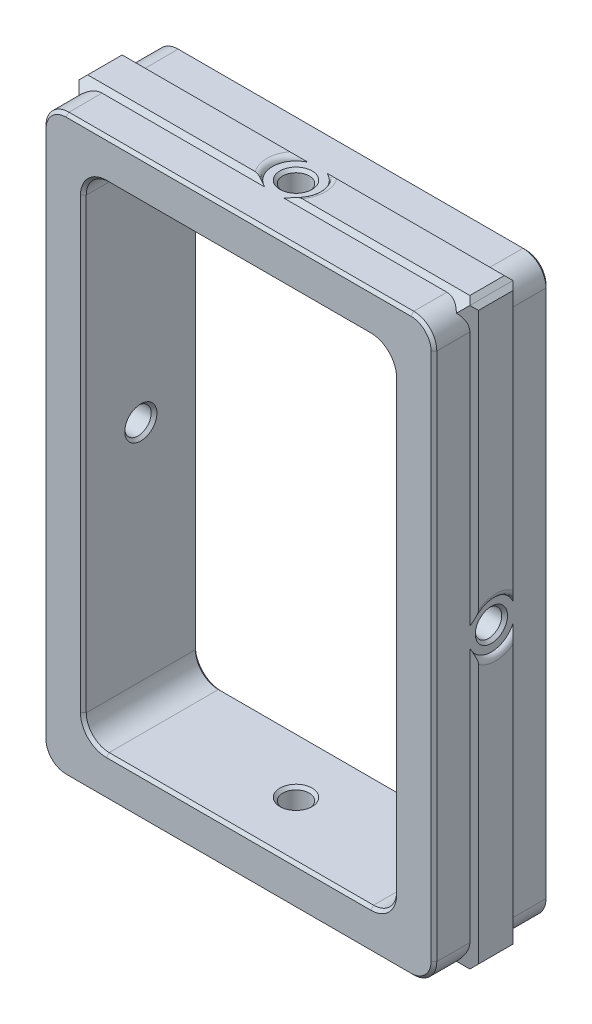
from build123d import *

# Parameters (mm, degrees)
SKIZZE1_W                       = 68
SKIZZE1_H                       = 100
AUFSATZ_LINEAR_AUSTRAGEN1_DEPTH = 20
AUFSATZ_LINEAR_AUSTRAGEN3_DEPTH = 100
AUFSATZ_LINEAR_AUSTRAGEN4_DEPTH = 68
SKIZZE5_R                       = 2.3
SCHNITT_LINEAR_AUSTRAGEN1_DEPTH = 20
SKIZZE6_R                       = 2.3
SCHNITT_LINEAR_AUSTRAGEN2_DEPTH = 20
SKIZZE7_R                       = 4.1
SCHNITT_LINEAR_AUSTRAGEN3_DEPTH = 20
SKIZZE8_R                       = 4.1
SCHNITT_LINEAR_AUSTRAGEN4_DEPTH = 20
VERRUNDUNG1_R                   = 1
FASE1_SIZE                      = 0.75
VERRUNDUNG2_R                   = 4
FILLET1_R                       = 4
CHAMFER1_SIZE                   = 0.5


# Some blends are built 0.0001 mm under size
with BuildPart() as part:
    # Skizze1 → Aufsatz-Linear austragen1 (new body)
    with BuildSketch(Plane.XY):
        with Locations((34, 50)):
            Rectangle(SKIZZE1_W, SKIZZE1_H)
        Polygon((11.132768182, 7), (7, 7), (7, 13.581815994), (7, 86.418184006), (7, 93), (11.132768182, 93), (56.867231818, 93), (61, 93), (61, 86.418184006), (61, 13.581815994), (61, 7), (56.867231818, 7), align=None, mode=Mode.SUBTRACT)
    extrude(amount=AUFSATZ_LINEAR_AUSTRAGEN1_DEPTH)

    # Skizze3 → Aufsatz-Linear austragen3 (add)
    with BuildSketch(Plane.XZ):
        Polygon((0, 13.75), (-0.75, 13), (-0.75, 7), (0, 6.25), align=None)
        Polygon((68, 13.75), (68.75, 13), (68.75, 7), (68, 6.25), align=None)
    extrude(amount=-AUFSATZ_LINEAR_AUSTRAGEN3_DEPTH)

    # Skizze4 → Aufsatz-Linear austragen4 (add)
    with BuildSketch(Plane.ZY):
        Polygon((13.75, 100), (13, 100.75), (7, 100.75), (6.25, 100), align=None)
        Polygon((13.75, 0), (13, -0.75), (7, -0.75), (6.25, 0), align=None)
    extrude(amount=-AUFSATZ_LINEAR_AUSTRAGEN4_DEPTH)

    # Skizze5 → Schnitt-Linear austragen1 (cut)
    with BuildSketch(Plane.XZ.offset(-93)):
        with Locations(Location((34, 10, 0), (0, 0, 270))):
            Circle(SKIZZE5_R)
    schnitt_linear_austragen1 = extrude(amount=-SCHNITT_LINEAR_AUSTRAGEN1_DEPTH, mode=Mode.SUBTRACT)

    # Skizze6 → Schnitt-Linear austragen2 (cut)
    with BuildSketch(Plane(origin=(7, 0, 0), x_dir=(0, 0, -1), z_dir=(1, 0, 0))):
        with Locations(Location((-10, 50, 0), (0, 0, 90))):
            Circle(SKIZZE6_R)
    schnitt_linear_austragen2 = extrude(amount=-SCHNITT_LINEAR_AUSTRAGEN2_DEPTH, mode=Mode.SUBTRACT)

    # Skizze7 → Schnitt-Linear austragen3 (cut)
    with BuildSketch(Plane(origin=(0, 100, 0), x_dir=(1, 0, 0), z_dir=(0, 1, 0))):
        with Locations((34, -10)):
            Circle(SKIZZE7_R)
    schnitt_linear_austragen3 = extrude(amount=SCHNITT_LINEAR_AUSTRAGEN3_DEPTH, mode=Mode.SUBTRACT)

    # Skizze8 → Schnitt-Linear austragen4 (cut)
    with BuildSketch(Plane.ZY):
        with Locations((10, 50)):
            Circle(SKIZZE8_R)
    schnitt_linear_austragen4 = extrude(amount=SCHNITT_LINEAR_AUSTRAGEN4_DEPTH, mode=Mode.SUBTRACT)

    # Spiegeln1: Schnitt-Linear austragen1, Schnitt-Linear austragen3 across plane
    add(schnitt_linear_austragen1.mirror(Plane.ZX.offset(50)), mode=Mode.SUBTRACT)
    add(schnitt_linear_austragen3.mirror(Plane.ZX.offset(50)), mode=Mode.SUBTRACT)

    # Spiegeln2: Schnitt-Linear austragen2, Schnitt-Linear austragen4 across plane
    add(schnitt_linear_austragen2.mirror(Plane.ZY.offset(-34)), mode=Mode.SUBTRACT)
    add(schnitt_linear_austragen4.mirror(Plane.ZY.offset(-34)), mode=Mode.SUBTRACT)

    # Verrundung1
    # the kernel refuses this fillet: 1 mm, written as the material it takes off along each edge
    with BuildSketch(Plane(origin=(-0.75, 50, 10), x_dir=(0, -0.15864693670846175, 0.9873353784165851), z_dir=(0, 0.9873353784165851, 0.15864693670846175))) as verrundung1_piece_1:
        with BuildLine():
            CenterArc((5.068245837, 1), VERRUNDUNG1_R, 194.477512186, 75.522487814)
            Line((5.068245837, 0), (5.068245837, -0.02))
            Line((5.068245837, -0.02), (4.1, -0.02))
            Line((4.1, -0.02), (4.08, 0))
            ThreePointArc((4.08, 0), (4.08, 0.375), (4.080635083, 0.745))
            Line((4.080635083, 0.745), (4.1, 0.75))
        make_face()
    revolve(axis=Axis((-0.75, 50, 10), (1, 0, 0)), revolution_arc=161.743263365, mode=Mode.SUBTRACT)
    with BuildSketch(Plane(origin=(-0.75, 50, 10), x_dir=(0, 0.15864693670846175, -0.9873353784165851), z_dir=(0, -0.9873353784165851, -0.15864693670846175))) as verrundung1_piece_2:
        with BuildLine():
            CenterArc((5.068245837, 1), VERRUNDUNG1_R, 194.477512186, 75.522487814)
            Line((5.068245837, 0), (5.068245837, -0.02))
            Line((5.068245837, -0.02), (4.1, -0.02))
            Line((4.1, -0.02), (4.08, 0))
            ThreePointArc((4.08, 0), (4.08, 0.375), (4.080635083, 0.745))
            Line((4.080635083, 0.745), (4.1, 0.75))
        make_face()
    revolve(axis=Axis((-0.75, 50, 10), (1, 0, 0)), revolution_arc=161.743263365, mode=Mode.SUBTRACT)
    with BuildSketch(Plane(origin=(34, 100.75, 10), x_dir=(0.15864693670847052, 0, 0.9873353784165836), z_dir=(-0.9873353784165836, 0, 0.15864693670847052))) as verrundung1_piece_3:
        with BuildLine():
            CenterArc((5.068245837, -1), VERRUNDUNG1_R, 90, 75.522487814)
            Line((5.068245837, 0), (5.068245837, 0.02))
            Line((5.068245837, 0.02), (4.1, 0.02))
            Line((4.1, 0.02), (4.08, 0))
            ThreePointArc((4.08, 0), (4.08, -0.375), (4.080635083, -0.745))
            Line((4.080635083, -0.745), (4.1, -0.75))
        make_face()
    revolve(axis=Axis((34, 100.75, 10), (0, 1, 0)), revolution_arc=161.743263365, mode=Mode.SUBTRACT)
    with BuildSketch(Plane(origin=(34, 100.75, 10), x_dir=(-0.15864693670847044, 0, 0.9873353784165836), z_dir=(0.9873353784165836, 0, 0.15864693670847044))) as verrundung1_piece_4:
        with BuildLine():
            CenterArc((5.068245837, 1), VERRUNDUNG1_R, 194.477512186, 75.522487814)
            Line((5.068245837, 0), (5.068245837, -0.02))
            Line((5.068245837, -0.02), (4.1, -0.02))
            Line((4.1, -0.02), (4.08, 0))
            ThreePointArc((4.08, 0), (4.08, 0.375), (4.080635083, 0.745))
            Line((4.080635083, 0.745), (4.1, 0.75))
        make_face()
    revolve(axis=Axis((34, 100.75, 10), (0, -1, 0)), revolution_arc=161.743263365, mode=Mode.SUBTRACT)
    with BuildSketch(Plane(origin=(68.75, 50, 10), x_dir=(0, -0.15864693670847907, -0.9873353784165824), z_dir=(0, 0.9873353784165824, -0.15864693670847907))) as verrundung1_piece_5:
        with BuildLine():
            CenterArc((5.068245837, 1), VERRUNDUNG1_R, 194.477512186, 75.522487814)
            Line((4.1, 0.75), (4.080635083, 0.745))
            ThreePointArc((4.080635083, 0.745), (4.08, 0.375), (4.08, 0))
            Line((4.08, 0), (4.1, -0.02))
            Line((4.1, -0.02), (5.068245837, -0.02))
            Line((5.068245837, -0.02), (5.068245837, 0))
        make_face()
    revolve(axis=Axis((68.75, 50, 10), (-1, 0, 0)), revolution_arc=161.743263365, mode=Mode.SUBTRACT)
    with BuildSketch(Plane(origin=(68.75, 50, 10), x_dir=(0, 0.15864693670846175, 0.9873353784165851), z_dir=(0, -0.9873353784165851, 0.15864693670846175))) as verrundung1_piece_6:
        with BuildLine():
            CenterArc((5.068245837, 1), VERRUNDUNG1_R, 194.477512186, 75.522487814)
            Line((5.068245837, 0), (5.068245837, -0.02))
            Line((5.068245837, -0.02), (4.1, -0.02))
            Line((4.1, -0.02), (4.08, 0))
            ThreePointArc((4.08, 0), (4.08, 0.375), (4.080635083, 0.745))
            Line((4.080635083, 0.745), (4.1, 0.75))
        make_face()
    revolve(axis=Axis((68.75, 50, 10), (-1, 0, 0)), revolution_arc=161.743263365, mode=Mode.SUBTRACT)
    with BuildSketch(Plane(origin=(34, -0.75, 10), x_dir=(0.1586469367084636, 0, -0.9873353784165849), z_dir=(-0.9873353784165849, 0, -0.1586469367084636))) as verrundung1_piece_7:
        with BuildLine():
            CenterArc((5.068245837, -1), VERRUNDUNG1_R, 90, 75.522487814)
            Line((5.068245837, 0), (5.068245837, 0.02))
            Line((5.068245837, 0.02), (4.1, 0.02))
            Line((4.1, 0.02), (4.08, 0))
            ThreePointArc((4.08, 0), (4.08, -0.375), (4.080635083, -0.745))
            Line((4.080635083, -0.745), (4.1, -0.75))
        make_face()
    revolve(axis=Axis((34, -0.75, 10), (0, -1, 0)), revolution_arc=161.743263365, mode=Mode.SUBTRACT)
    with BuildSketch(Plane(origin=(34, -0.75, 10), x_dir=(-0.15864693670846183, 0, -0.9873353784165851), z_dir=(0.9873353784165851, 0, -0.15864693670846183))) as verrundung1_piece_8:
        with BuildLine():
            CenterArc((5.068245837, 1), VERRUNDUNG1_R, 194.477512186, 75.522487814)
            Line((5.068245837, 0), (5.068245837, -0.02))
            Line((5.068245837, -0.02), (4.1, -0.02))
            Line((4.1, -0.02), (4.08, 0))
            ThreePointArc((4.08, 0), (4.08, 0.375), (4.080635083, 0.745))
            Line((4.080635083, 0.745), (4.1, 0.75))
        make_face()
    revolve(axis=Axis((34, -0.75, 10), (0, 1, 0)), revolution_arc=161.743263365, mode=Mode.SUBTRACT)

    # Fase1
    fase1_edges = [part.edges().sort_by_distance(p)[0] for p in [
        (68.75, 100, 10),
        (68.75, 0, 10),
        (68, 100.75, 10),
        (-0.75, 0, 10),
        (-0.75, 100, 10),
        (0, 100.75, 10),
        (0, -0.75, 10),
        (68, -0.75, 10),
    ]]
    chamfer(fase1_edges, length=FASE1_SIZE - 0.0001)  # a hair under: the kernel refuses the full size

    # Verrundung2
    # the kernel refuses this fillet: 4 mm, written as the material it takes off along each edge
    with BuildSketch(Plane(origin=(0, 0, 3.75), x_dir=(1, 0, 0), z_dir=(0, 0, 1))) as verrundung2_piece_1_section:
        with BuildLine():
            CenterArc((VERRUNDUNG2_R, VERRUNDUNG2_R), VERRUNDUNG2_R, 180, 90)
            Line((0, VERRUNDUNG2_R), (0, 0))
            Line((0, 0), (VERRUNDUNG2_R, 0))
        make_face()
    verrundung2_piece_1 = extrude(amount=26.25, mode=Mode.PRIVATE)
    verrundung2_piece_1 = split(verrundung2_piece_1, bisect_by=Plane(origin=(2.04000306, 0.608628582, 5.641371418), z_dir=(0, -0.7071067811865519, -0.7071067811865434)), keep=Keep.TOP, mode=Mode.PRIVATE)
    verrundung2_piece_1 = split(verrundung2_piece_1, bisect_by=Plane(origin=(1.537282973, 0.182694278, 4.712717027), z_dir=(0.7071067811865467, 0, 0.7071067811865483)), keep=Keep.TOP, mode=Mode.PRIVATE)
    add(verrundung2_piece_1, mode=Mode.SUBTRACT)
    with BuildSketch(Plane(origin=(0, 0, 3.75), x_dir=(1, 0, 0), z_dir=(0, 0, 1))) as verrundung2_piece_2_section:
        with BuildLine():
            CenterArc((VERRUNDUNG2_R, VERRUNDUNG2_R), VERRUNDUNG2_R, 180, 90)
            Line((0, VERRUNDUNG2_R), (0, 0))
            Line((0, 0), (VERRUNDUNG2_R, 0))
        make_face()
    verrundung2_piece_2 = extrude(amount=26.25, mode=Mode.PRIVATE)
    verrundung2_piece_2 = split(verrundung2_piece_2, bisect_by=Plane(origin=(0.675367525, 1.214801338, 5.035198662), z_dir=(0, -0.7071067811865519, -0.7071067811865434)), keep=Keep.TOP, mode=Mode.PRIVATE)
    verrundung2_piece_2 = split(verrundung2_piece_2, bisect_by=Plane(origin=(1.214801338, 0.675367525, 5.035198662), z_dir=(-0.7071067811865467, 0, -0.7071067811865483)), keep=Keep.TOP, mode=Mode.PRIVATE)
    add(verrundung2_piece_2, mode=Mode.SUBTRACT)
    with BuildSketch(Plane(origin=(0, 0, 3.75), x_dir=(1, 0, 0), z_dir=(0, 0, 1))) as verrundung2_piece_3_section:
        with BuildLine():
            CenterArc((VERRUNDUNG2_R, VERRUNDUNG2_R), VERRUNDUNG2_R, 180, 90)
            Line((0, VERRUNDUNG2_R), (0, 0))
            Line((0, 0), (VERRUNDUNG2_R, 0))
        make_face()
    verrundung2_piece_3 = extrude(amount=26.25, mode=Mode.PRIVATE)
    verrundung2_piece_3 = split(verrundung2_piece_3, bisect_by=Plane(origin=(0.182694278, 1.537282973, 4.712717027), z_dir=(0, 0.7071067811865519, 0.7071067811865434)), keep=Keep.TOP, mode=Mode.PRIVATE)
    verrundung2_piece_3 = split(verrundung2_piece_3, bisect_by=Plane(origin=(0.608628582, 2.04000306, 5.641371418), z_dir=(-0.7071067811865467, 0, -0.7071067811865483)), keep=Keep.TOP, mode=Mode.PRIVATE)
    add(verrundung2_piece_3, mode=Mode.SUBTRACT)
    with BuildSketch(Plane(origin=(0, 0, 3.75), x_dir=(1, 0, 0), z_dir=(0, 0, 1))) as verrundung2_piece_4_section:
        with BuildLine():
            CenterArc((VERRUNDUNG2_R, VERRUNDUNG2_R), VERRUNDUNG2_R, 180, 90)
            Line((0, VERRUNDUNG2_R), (0, 0))
            Line((0, 0), (VERRUNDUNG2_R, 0))
        make_face()
    verrundung2_piece_4 = extrude(amount=26.25, mode=Mode.PRIVATE)
    verrundung2_piece_4 = split(verrundung2_piece_4, bisect_by=Plane(origin=(0.171927832, 1.629764539, 15.379764539), z_dir=(0, 0.7071067811865515, -0.7071067811865437)), keep=Keep.TOP, mode=Mode.PRIVATE)
    verrundung2_piece_4 = split(verrundung2_piece_4, bisect_by=Plane(origin=(0.657873401, 2.115710108, 14.407873401), z_dir=(-0.707106781186546, 0, 0.7071067811865491)), keep=Keep.TOP, mode=Mode.PRIVATE)
    add(verrundung2_piece_4, mode=Mode.SUBTRACT)
    with BuildSketch(Plane(origin=(0, 0, 3.75), x_dir=(1, 0, 0), z_dir=(0, 0, 1))) as verrundung2_piece_5_section:
        with BuildLine():
            CenterArc((VERRUNDUNG2_R, VERRUNDUNG2_R), VERRUNDUNG2_R, 180, 90)
            Line((0, VERRUNDUNG2_R), (0, 0))
            Line((0, 0), (VERRUNDUNG2_R, 0))
        make_face()
    verrundung2_piece_5 = extrude(amount=26.25, mode=Mode.PRIVATE)
    verrundung2_piece_5 = split(verrundung2_piece_5, bisect_by=Plane(origin=(2.115710108, 0.657873401, 14.407873401), z_dir=(0, -0.7071067811865515, 0.7071067811865437)), keep=Keep.TOP, mode=Mode.PRIVATE)
    verrundung2_piece_5 = split(verrundung2_piece_5, bisect_by=Plane(origin=(1.629764539, 0.171927832, 15.379764539), z_dir=(0.707106781186546, 0, -0.7071067811865491)), keep=Keep.TOP, mode=Mode.PRIVATE)
    add(verrundung2_piece_5, mode=Mode.SUBTRACT)
    with BuildSketch(Plane(origin=(0, 0, 3.75), x_dir=(1, 0, 0), z_dir=(0, 0, 1))) as verrundung2_piece_6_section:
        with BuildLine():
            CenterArc((VERRUNDUNG2_R, VERRUNDUNG2_R), VERRUNDUNG2_R, 180, 90)
            Line((0, VERRUNDUNG2_R), (0, 0))
            Line((0, 0), (VERRUNDUNG2_R, 0))
        make_face()
    verrundung2_piece_6 = extrude(amount=26.25, mode=Mode.PRIVATE)
    verrundung2_piece_6 = split(verrundung2_piece_6, bisect_by=Plane(origin=(0.885415687, 4.872494138, 18.622494138), z_dir=(0, -0.7071067811865515, 0.7071067811865437)), keep=Keep.TOP, mode=Mode.PRIVATE)
    verrundung2_piece_6 = split(verrundung2_piece_6, bisect_by=Plane(origin=(4.872494138, 0.885415687, 18.622494138), z_dir=(-0.707106781186546, 0, 0.7071067811865491)), keep=Keep.TOP, mode=Mode.PRIVATE)
    add(verrundung2_piece_6, mode=Mode.SUBTRACT)
    with BuildSketch(Plane(origin=(0, 100, 3.75), x_dir=(0, -1, 0), z_dir=(0, 0, 1))) as verrundung2_piece_7_section:
        with BuildLine():
            CenterArc((VERRUNDUNG2_R, VERRUNDUNG2_R), VERRUNDUNG2_R, 180, 90)
            Line((0, VERRUNDUNG2_R), (0, 0))
            Line((0, 0), (VERRUNDUNG2_R, 0))
        make_face()
    verrundung2_piece_7 = extrude(amount=26.25, mode=Mode.PRIVATE)
    verrundung2_piece_7 = split(verrundung2_piece_7, bisect_by=Plane(origin=(0.608628582, 97.95999694, 5.641371418), z_dir=(-0.7071067811865467, 0, -0.7071067811865483)), keep=Keep.TOP, mode=Mode.PRIVATE)
    verrundung2_piece_7 = split(verrundung2_piece_7, bisect_by=Plane(origin=(0.182694278, 98.462717027, 4.712717027), z_dir=(0, -0.7071067811865521, 0.7071067811865429)), keep=Keep.TOP, mode=Mode.PRIVATE)
    add(verrundung2_piece_7, mode=Mode.SUBTRACT)
    with BuildSketch(Plane(origin=(0, 100, 3.75), x_dir=(0, -1, 0), z_dir=(0, 0, 1))) as verrundung2_piece_8_section:
        with BuildLine():
            CenterArc((VERRUNDUNG2_R, VERRUNDUNG2_R), VERRUNDUNG2_R, 180, 90)
            Line((0, VERRUNDUNG2_R), (0, 0))
            Line((0, 0), (VERRUNDUNG2_R, 0))
        make_face()
    verrundung2_piece_8 = extrude(amount=26.25, mode=Mode.PRIVATE)
    verrundung2_piece_8 = split(verrundung2_piece_8, bisect_by=Plane(origin=(1.214801338, 99.324632475, 5.035198662), z_dir=(-0.7071067811865467, 0, -0.7071067811865483)), keep=Keep.TOP, mode=Mode.PRIVATE)
    verrundung2_piece_8 = split(verrundung2_piece_8, bisect_by=Plane(origin=(0.675367525, 98.785198662, 5.035198662), z_dir=(0, 0.7071067811865521, -0.7071067811865429)), keep=Keep.TOP, mode=Mode.PRIVATE)
    add(verrundung2_piece_8, mode=Mode.SUBTRACT)
    with BuildSketch(Plane(origin=(0, 100, 3.75), x_dir=(0, -1, 0), z_dir=(0, 0, 1))) as verrundung2_piece_9_section:
        with BuildLine():
            CenterArc((VERRUNDUNG2_R, VERRUNDUNG2_R), VERRUNDUNG2_R, 180, 90)
            Line((0, VERRUNDUNG2_R), (0, 0))
            Line((0, 0), (VERRUNDUNG2_R, 0))
        make_face()
    verrundung2_piece_9 = extrude(amount=26.25, mode=Mode.PRIVATE)
    verrundung2_piece_9 = split(verrundung2_piece_9, bisect_by=Plane(origin=(1.537282973, 99.817305722, 4.712717027), z_dir=(0.7071067811865467, 0, 0.7071067811865483)), keep=Keep.TOP, mode=Mode.PRIVATE)
    verrundung2_piece_9 = split(verrundung2_piece_9, bisect_by=Plane(origin=(2.04000306, 99.391371418, 5.641371418), z_dir=(0, 0.7071067811865521, -0.7071067811865429)), keep=Keep.TOP, mode=Mode.PRIVATE)
    add(verrundung2_piece_9, mode=Mode.SUBTRACT)
    with BuildSketch(Plane(origin=(0, 100, 3.75), x_dir=(0, -1, 0), z_dir=(0, 0, 1))) as verrundung2_piece_10_section:
        with BuildLine():
            CenterArc((VERRUNDUNG2_R, VERRUNDUNG2_R), VERRUNDUNG2_R, 180, 90)
            Line((0, VERRUNDUNG2_R), (0, 0))
            Line((0, 0), (VERRUNDUNG2_R, 0))
        make_face()
    verrundung2_piece_10 = extrude(amount=26.25, mode=Mode.PRIVATE)
    verrundung2_piece_10 = split(verrundung2_piece_10, bisect_by=Plane(origin=(1.629764539, 99.828072168, 15.379764539), z_dir=(0.707106781186546, 0, -0.7071067811865491)), keep=Keep.TOP, mode=Mode.PRIVATE)
    verrundung2_piece_10 = split(verrundung2_piece_10, bisect_by=Plane(origin=(2.115710108, 99.342126599, 14.407873401), z_dir=(0, 0.7071067811865518, 0.7071067811865434)), keep=Keep.TOP, mode=Mode.PRIVATE)
    add(verrundung2_piece_10, mode=Mode.SUBTRACT)
    with BuildSketch(Plane(origin=(0, 100, 3.75), x_dir=(0, -1, 0), z_dir=(0, 0, 1))) as verrundung2_piece_11_section:
        with BuildLine():
            CenterArc((VERRUNDUNG2_R, VERRUNDUNG2_R), VERRUNDUNG2_R, 180, 90)
            Line((0, VERRUNDUNG2_R), (0, 0))
            Line((0, 0), (VERRUNDUNG2_R, 0))
        make_face()
    verrundung2_piece_11 = extrude(amount=26.25, mode=Mode.PRIVATE)
    verrundung2_piece_11 = split(verrundung2_piece_11, bisect_by=Plane(origin=(0.657873401, 97.884289892, 14.407873401), z_dir=(-0.707106781186546, 0, 0.7071067811865491)), keep=Keep.TOP, mode=Mode.PRIVATE)
    verrundung2_piece_11 = split(verrundung2_piece_11, bisect_by=Plane(origin=(0.171927832, 98.370235461, 15.379764539), z_dir=(0, -0.7071067811865518, -0.7071067811865434)), keep=Keep.TOP, mode=Mode.PRIVATE)
    add(verrundung2_piece_11, mode=Mode.SUBTRACT)
    with BuildSketch(Plane(origin=(0, 100, 3.75), x_dir=(0, -1, 0), z_dir=(0, 0, 1))) as verrundung2_piece_12_section:
        with BuildLine():
            CenterArc((VERRUNDUNG2_R, VERRUNDUNG2_R), VERRUNDUNG2_R, 180, 90)
            Line((0, VERRUNDUNG2_R), (0, 0))
            Line((0, 0), (VERRUNDUNG2_R, 0))
        make_face()
    verrundung2_piece_12 = extrude(amount=26.25, mode=Mode.PRIVATE)
    verrundung2_piece_12 = split(verrundung2_piece_12, bisect_by=Plane(origin=(4.872494138, 99.114584313, 18.622494138), z_dir=(-0.707106781186546, 0, 0.7071067811865491)), keep=Keep.TOP, mode=Mode.PRIVATE)
    verrundung2_piece_12 = split(verrundung2_piece_12, bisect_by=Plane(origin=(0.885415687, 95.127505862, 18.622494138), z_dir=(0, 0.7071067811865518, 0.7071067811865434)), keep=Keep.TOP, mode=Mode.PRIVATE)
    add(verrundung2_piece_12, mode=Mode.SUBTRACT)
    with BuildSketch(Plane(origin=(68, 100, 3.75), x_dir=(0, -1, 0), z_dir=(0, 0, 1))) as verrundung2_piece_13_section:
        with BuildLine():
            CenterArc((VERRUNDUNG2_R, -VERRUNDUNG2_R), VERRUNDUNG2_R, 90, 90)
            Line((0, -VERRUNDUNG2_R), (0, 0))
            Line((0, 0), (VERRUNDUNG2_R, 0))
        make_face()
    verrundung2_piece_13 = extrude(amount=26.25, mode=Mode.PRIVATE)
    verrundung2_piece_13 = split(verrundung2_piece_13, bisect_by=Plane(origin=(67.391371418, 97.95999694, 5.641371418), z_dir=(0.7071067811865542, 0, -0.7071067811865409)), keep=Keep.TOP, mode=Mode.PRIVATE)
    verrundung2_piece_13 = split(verrundung2_piece_13, bisect_by=Plane(origin=(67.817305722, 98.462717027, 4.712717027), z_dir=(0, -0.7071067811865521, 0.7071067811865429)), keep=Keep.TOP, mode=Mode.PRIVATE)
    add(verrundung2_piece_13, mode=Mode.SUBTRACT)
    with BuildSketch(Plane(origin=(68, 100, 3.75), x_dir=(0, -1, 0), z_dir=(0, 0, 1))) as verrundung2_piece_14_section:
        with BuildLine():
            CenterArc((VERRUNDUNG2_R, -VERRUNDUNG2_R), VERRUNDUNG2_R, 90, 90)
            Line((0, -VERRUNDUNG2_R), (0, 0))
            Line((0, 0), (VERRUNDUNG2_R, 0))
        make_face()
    verrundung2_piece_14 = extrude(amount=26.25, mode=Mode.PRIVATE)
    verrundung2_piece_14 = split(verrundung2_piece_14, bisect_by=Plane(origin=(66.785198662, 99.324632475, 5.035198662), z_dir=(0.7071067811865542, 0, -0.7071067811865409)), keep=Keep.TOP, mode=Mode.PRIVATE)
    verrundung2_piece_14 = split(verrundung2_piece_14, bisect_by=Plane(origin=(67.324632475, 98.785198662, 5.035198662), z_dir=(0, 0.7071067811865521, -0.7071067811865429)), keep=Keep.TOP, mode=Mode.PRIVATE)
    add(verrundung2_piece_14, mode=Mode.SUBTRACT)
    with BuildSketch(Plane(origin=(68, 100, 3.75), x_dir=(0, -1, 0), z_dir=(0, 0, 1))) as verrundung2_piece_15_section:
        with BuildLine():
            CenterArc((VERRUNDUNG2_R, -VERRUNDUNG2_R), VERRUNDUNG2_R, 90, 90)
            Line((0, -VERRUNDUNG2_R), (0, 0))
            Line((0, 0), (VERRUNDUNG2_R, 0))
        make_face()
    verrundung2_piece_15 = extrude(amount=26.25, mode=Mode.PRIVATE)
    verrundung2_piece_15 = split(verrundung2_piece_15, bisect_by=Plane(origin=(66.462717027, 99.817305722, 4.712717027), z_dir=(-0.7071067811865542, 0, 0.7071067811865409)), keep=Keep.TOP, mode=Mode.PRIVATE)
    verrundung2_piece_15 = split(verrundung2_piece_15, bisect_by=Plane(origin=(65.95999694, 99.391371418, 5.641371418), z_dir=(0, 0.7071067811865521, -0.7071067811865429)), keep=Keep.TOP, mode=Mode.PRIVATE)
    add(verrundung2_piece_15, mode=Mode.SUBTRACT)
    with BuildSketch(Plane(origin=(68, 100, 3.75), x_dir=(0, -1, 0), z_dir=(0, 0, 1))) as verrundung2_piece_16_section:
        with BuildLine():
            CenterArc((VERRUNDUNG2_R, -VERRUNDUNG2_R), VERRUNDUNG2_R, 90, 90)
            Line((0, -VERRUNDUNG2_R), (0, 0))
            Line((0, 0), (VERRUNDUNG2_R, 0))
        make_face()
    verrundung2_piece_16 = extrude(amount=26.25, mode=Mode.PRIVATE)
    verrundung2_piece_16 = split(verrundung2_piece_16, bisect_by=Plane(origin=(66.370235461, 99.828072168, 15.379764539), z_dir=(-0.7071067811865533, 0, -0.7071067811865417)), keep=Keep.TOP, mode=Mode.PRIVATE)
    verrundung2_piece_16 = split(verrundung2_piece_16, bisect_by=Plane(origin=(65.884289892, 99.342126599, 14.407873401), z_dir=(0, 0.7071067811865518, 0.7071067811865434)), keep=Keep.TOP, mode=Mode.PRIVATE)
    add(verrundung2_piece_16, mode=Mode.SUBTRACT)
    with BuildSketch(Plane(origin=(68, 100, 3.75), x_dir=(0, -1, 0), z_dir=(0, 0, 1))) as verrundung2_piece_17_section:
        with BuildLine():
            CenterArc((VERRUNDUNG2_R, -VERRUNDUNG2_R), VERRUNDUNG2_R, 90, 90)
            Line((0, -VERRUNDUNG2_R), (0, 0))
            Line((0, 0), (VERRUNDUNG2_R, 0))
        make_face()
    verrundung2_piece_17 = extrude(amount=26.25, mode=Mode.PRIVATE)
    verrundung2_piece_17 = split(verrundung2_piece_17, bisect_by=Plane(origin=(67.342126599, 97.884289892, 14.407873401), z_dir=(0.7071067811865533, 0, 0.7071067811865417)), keep=Keep.TOP, mode=Mode.PRIVATE)
    verrundung2_piece_17 = split(verrundung2_piece_17, bisect_by=Plane(origin=(67.828072168, 98.370235461, 15.379764539), z_dir=(0, -0.7071067811865518, -0.7071067811865434)), keep=Keep.TOP, mode=Mode.PRIVATE)
    add(verrundung2_piece_17, mode=Mode.SUBTRACT)
    with BuildSketch(Plane(origin=(68, 100, 3.75), x_dir=(0, -1, 0), z_dir=(0, 0, 1))) as verrundung2_piece_18_section:
        with BuildLine():
            CenterArc((VERRUNDUNG2_R, -VERRUNDUNG2_R), VERRUNDUNG2_R, 90, 90)
            Line((0, -VERRUNDUNG2_R), (0, 0))
            Line((0, 0), (VERRUNDUNG2_R, 0))
        make_face()
    verrundung2_piece_18 = extrude(amount=26.25, mode=Mode.PRIVATE)
    verrundung2_piece_18 = split(verrundung2_piece_18, bisect_by=Plane(origin=(63.127505862, 99.114584313, 18.622494138), z_dir=(0.7071067811865533, 0, 0.7071067811865417)), keep=Keep.TOP, mode=Mode.PRIVATE)
    verrundung2_piece_18 = split(verrundung2_piece_18, bisect_by=Plane(origin=(67.114584313, 95.127505862, 18.622494138), z_dir=(0, 0.7071067811865518, 0.7071067811865434)), keep=Keep.TOP, mode=Mode.PRIVATE)
    add(verrundung2_piece_18, mode=Mode.SUBTRACT)
    with BuildSketch(Plane(origin=(68, 0, 3.75), x_dir=(-1, 0, 0), z_dir=(0, 0, 1))) as verrundung2_piece_19_section:
        with BuildLine():
            CenterArc((VERRUNDUNG2_R, -VERRUNDUNG2_R), VERRUNDUNG2_R, 90, 90)
            Line((0, -VERRUNDUNG2_R), (0, 0))
            Line((0, 0), (VERRUNDUNG2_R, 0))
        make_face()
    verrundung2_piece_19 = extrude(amount=26.25, mode=Mode.PRIVATE)
    verrundung2_piece_19 = split(verrundung2_piece_19, bisect_by=Plane(origin=(65.95999694, 0.608628582, 5.641371418), z_dir=(0, -0.7071067811865519, -0.7071067811865434)), keep=Keep.TOP, mode=Mode.PRIVATE)
    verrundung2_piece_19 = split(verrundung2_piece_19, bisect_by=Plane(origin=(66.462717027, 0.182694278, 4.712717027), z_dir=(-0.7071067811865542, 0, 0.7071067811865409)), keep=Keep.TOP, mode=Mode.PRIVATE)
    add(verrundung2_piece_19, mode=Mode.SUBTRACT)
    with BuildSketch(Plane(origin=(68, 0, 3.75), x_dir=(-1, 0, 0), z_dir=(0, 0, 1))) as verrundung2_piece_20_section:
        with BuildLine():
            CenterArc((VERRUNDUNG2_R, -VERRUNDUNG2_R), VERRUNDUNG2_R, 90, 90)
            Line((0, -VERRUNDUNG2_R), (0, 0))
            Line((0, 0), (VERRUNDUNG2_R, 0))
        make_face()
    verrundung2_piece_20 = extrude(amount=26.25, mode=Mode.PRIVATE)
    verrundung2_piece_20 = split(verrundung2_piece_20, bisect_by=Plane(origin=(67.324632475, 1.214801338, 5.035198662), z_dir=(0, -0.7071067811865519, -0.7071067811865434)), keep=Keep.TOP, mode=Mode.PRIVATE)
    verrundung2_piece_20 = split(verrundung2_piece_20, bisect_by=Plane(origin=(66.785198662, 0.675367525, 5.035198662), z_dir=(0.7071067811865542, 0, -0.7071067811865409)), keep=Keep.TOP, mode=Mode.PRIVATE)
    add(verrundung2_piece_20, mode=Mode.SUBTRACT)
    with BuildSketch(Plane(origin=(68, 0, 3.75), x_dir=(-1, 0, 0), z_dir=(0, 0, 1))) as verrundung2_piece_21_section:
        with BuildLine():
            CenterArc((VERRUNDUNG2_R, -VERRUNDUNG2_R), VERRUNDUNG2_R, 90, 90)
            Line((0, -VERRUNDUNG2_R), (0, 0))
            Line((0, 0), (VERRUNDUNG2_R, 0))
        make_face()
    verrundung2_piece_21 = extrude(amount=26.25, mode=Mode.PRIVATE)
    verrundung2_piece_21 = split(verrundung2_piece_21, bisect_by=Plane(origin=(67.817305722, 1.537282973, 4.712717027), z_dir=(0, 0.7071067811865519, 0.7071067811865434)), keep=Keep.TOP, mode=Mode.PRIVATE)
    verrundung2_piece_21 = split(verrundung2_piece_21, bisect_by=Plane(origin=(67.391371418, 2.04000306, 5.641371418), z_dir=(0.7071067811865542, 0, -0.7071067811865409)), keep=Keep.TOP, mode=Mode.PRIVATE)
    add(verrundung2_piece_21, mode=Mode.SUBTRACT)
    with BuildSketch(Plane(origin=(68, 0, 3.75), x_dir=(-1, 0, 0), z_dir=(0, 0, 1))) as verrundung2_piece_22_section:
        with BuildLine():
            CenterArc((VERRUNDUNG2_R, -VERRUNDUNG2_R), VERRUNDUNG2_R, 90, 90)
            Line((0, -VERRUNDUNG2_R), (0, 0))
            Line((0, 0), (VERRUNDUNG2_R, 0))
        make_face()
    verrundung2_piece_22 = extrude(amount=26.25, mode=Mode.PRIVATE)
    verrundung2_piece_22 = split(verrundung2_piece_22, bisect_by=Plane(origin=(67.828072168, 1.629764539, 15.379764539), z_dir=(0, 0.7071067811865515, -0.7071067811865437)), keep=Keep.TOP, mode=Mode.PRIVATE)
    verrundung2_piece_22 = split(verrundung2_piece_22, bisect_by=Plane(origin=(67.342126599, 2.115710108, 14.407873401), z_dir=(0.7071067811865533, 0, 0.7071067811865417)), keep=Keep.TOP, mode=Mode.PRIVATE)
    add(verrundung2_piece_22, mode=Mode.SUBTRACT)
    with BuildSketch(Plane(origin=(68, 0, 3.75), x_dir=(-1, 0, 0), z_dir=(0, 0, 1))) as verrundung2_piece_23_section:
        with BuildLine():
            CenterArc((VERRUNDUNG2_R, -VERRUNDUNG2_R), VERRUNDUNG2_R, 90, 90)
            Line((0, -VERRUNDUNG2_R), (0, 0))
            Line((0, 0), (VERRUNDUNG2_R, 0))
        make_face()
    verrundung2_piece_23 = extrude(amount=26.25, mode=Mode.PRIVATE)
    verrundung2_piece_23 = split(verrundung2_piece_23, bisect_by=Plane(origin=(65.884289892, 0.657873401, 14.407873401), z_dir=(0, -0.7071067811865515, 0.7071067811865437)), keep=Keep.TOP, mode=Mode.PRIVATE)
    verrundung2_piece_23 = split(verrundung2_piece_23, bisect_by=Plane(origin=(66.370235461, 0.171927832, 15.379764539), z_dir=(-0.7071067811865533, 0, -0.7071067811865417)), keep=Keep.TOP, mode=Mode.PRIVATE)
    add(verrundung2_piece_23, mode=Mode.SUBTRACT)
    with BuildSketch(Plane(origin=(68, 0, 3.75), x_dir=(-1, 0, 0), z_dir=(0, 0, 1))) as verrundung2_piece_24_section:
        with BuildLine():
            CenterArc((VERRUNDUNG2_R, -VERRUNDUNG2_R), VERRUNDUNG2_R, 90, 90)
            Line((0, -VERRUNDUNG2_R), (0, 0))
            Line((0, 0), (VERRUNDUNG2_R, 0))
        make_face()
    verrundung2_piece_24 = extrude(amount=26.25, mode=Mode.PRIVATE)
    verrundung2_piece_24 = split(verrundung2_piece_24, bisect_by=Plane(origin=(67.114584313, 4.872494138, 18.622494138), z_dir=(0, -0.7071067811865515, 0.7071067811865437)), keep=Keep.TOP, mode=Mode.PRIVATE)
    verrundung2_piece_24 = split(verrundung2_piece_24, bisect_by=Plane(origin=(63.127505862, 0.885415687, 18.622494138), z_dir=(0.7071067811865533, 0, 0.7071067811865417)), keep=Keep.TOP, mode=Mode.PRIVATE)
    add(verrundung2_piece_24, mode=Mode.SUBTRACT)
    with BuildSketch(Plane(origin=(0, 0, -10), x_dir=(1, 0, 0), z_dir=(0, 0, 1))) as verrundung2_piece_25_section:
        with BuildLine():
            CenterArc((VERRUNDUNG2_R, VERRUNDUNG2_R), VERRUNDUNG2_R, 180, 90)
            Line((0, VERRUNDUNG2_R), (0, 0))
            Line((0, 0), (VERRUNDUNG2_R, 0))
        make_face()
    verrundung2_piece_25 = extrude(amount=26.25, mode=Mode.PRIVATE)
    verrundung2_piece_25 = split(verrundung2_piece_25, bisect_by=Plane(origin=(0.885415687, 4.872494138, 1.377505862), z_dir=(0, -0.7071067811865519, -0.7071067811865434)), keep=Keep.TOP, mode=Mode.PRIVATE)
    verrundung2_piece_25 = split(verrundung2_piece_25, bisect_by=Plane(origin=(4.872494138, 0.885415687, 1.377505862), z_dir=(-0.7071067811865467, 0, -0.7071067811865483)), keep=Keep.TOP, mode=Mode.PRIVATE)
    add(verrundung2_piece_25, mode=Mode.SUBTRACT)
    with BuildSketch(Plane(origin=(0, 0, -10), x_dir=(1, 0, 0), z_dir=(0, 0, 1))) as verrundung2_piece_26_section:
        with BuildLine():
            CenterArc((VERRUNDUNG2_R, VERRUNDUNG2_R), VERRUNDUNG2_R, 180, 90)
            Line((0, VERRUNDUNG2_R), (0, 0))
            Line((0, 0), (VERRUNDUNG2_R, 0))
        make_face()
    verrundung2_piece_26 = extrude(amount=26.25, mode=Mode.PRIVATE)
    verrundung2_piece_26 = split(verrundung2_piece_26, bisect_by=Plane(origin=(0.171927832, 1.629764539, 4.620235461), z_dir=(0, 0.7071067811865519, 0.7071067811865434)), keep=Keep.TOP, mode=Mode.PRIVATE)
    verrundung2_piece_26 = split(verrundung2_piece_26, bisect_by=Plane(origin=(0.657873401, 2.115710108, 5.592126599), z_dir=(-0.7071067811865467, 0, -0.7071067811865483)), keep=Keep.TOP, mode=Mode.PRIVATE)
    add(verrundung2_piece_26, mode=Mode.SUBTRACT)
    with BuildSketch(Plane(origin=(0, 0, -10), x_dir=(1, 0, 0), z_dir=(0, 0, 1))) as verrundung2_piece_27_section:
        with BuildLine():
            CenterArc((VERRUNDUNG2_R, VERRUNDUNG2_R), VERRUNDUNG2_R, 180, 90)
            Line((0, VERRUNDUNG2_R), (0, 0))
            Line((0, 0), (VERRUNDUNG2_R, 0))
        make_face()
    verrundung2_piece_27 = extrude(amount=26.25, mode=Mode.PRIVATE)
    verrundung2_piece_27 = split(verrundung2_piece_27, bisect_by=Plane(origin=(2.115710108, 0.657873401, 5.592126599), z_dir=(0, -0.7071067811865519, -0.7071067811865434)), keep=Keep.TOP, mode=Mode.PRIVATE)
    verrundung2_piece_27 = split(verrundung2_piece_27, bisect_by=Plane(origin=(1.629764539, 0.171927832, 4.620235461), z_dir=(0.7071067811865467, 0, 0.7071067811865483)), keep=Keep.TOP, mode=Mode.PRIVATE)
    add(verrundung2_piece_27, mode=Mode.SUBTRACT)
    with BuildSketch(Plane(origin=(0, 0, -10), x_dir=(1, 0, 0), z_dir=(0, 0, 1))) as verrundung2_piece_28_section:
        with BuildLine():
            CenterArc((VERRUNDUNG2_R, VERRUNDUNG2_R), VERRUNDUNG2_R, 180, 90)
            Line((0, VERRUNDUNG2_R), (0, 0))
            Line((0, 0), (VERRUNDUNG2_R, 0))
        make_face()
    verrundung2_piece_28 = extrude(amount=26.25, mode=Mode.PRIVATE)
    verrundung2_piece_28 = split(verrundung2_piece_28, bisect_by=Plane(origin=(0.182694278, 1.537282973, 15.287282973), z_dir=(0, 0.7071067811865515, -0.7071067811865437)), keep=Keep.TOP, mode=Mode.PRIVATE)
    verrundung2_piece_28 = split(verrundung2_piece_28, bisect_by=Plane(origin=(0.608628582, 2.04000306, 14.358628582), z_dir=(-0.707106781186546, 0, 0.7071067811865491)), keep=Keep.TOP, mode=Mode.PRIVATE)
    add(verrundung2_piece_28, mode=Mode.SUBTRACT)
    with BuildSketch(Plane(origin=(0, 0, -10), x_dir=(1, 0, 0), z_dir=(0, 0, 1))) as verrundung2_piece_29_section:
        with BuildLine():
            CenterArc((VERRUNDUNG2_R, VERRUNDUNG2_R), VERRUNDUNG2_R, 180, 90)
            Line((0, VERRUNDUNG2_R), (0, 0))
            Line((0, 0), (VERRUNDUNG2_R, 0))
        make_face()
    verrundung2_piece_29 = extrude(amount=26.25, mode=Mode.PRIVATE)
    verrundung2_piece_29 = split(verrundung2_piece_29, bisect_by=Plane(origin=(2.04000306, 0.608628582, 14.358628582), z_dir=(0, -0.7071067811865515, 0.7071067811865437)), keep=Keep.TOP, mode=Mode.PRIVATE)
    verrundung2_piece_29 = split(verrundung2_piece_29, bisect_by=Plane(origin=(1.537282973, 0.182694278, 15.287282973), z_dir=(0.707106781186546, 0, -0.7071067811865491)), keep=Keep.TOP, mode=Mode.PRIVATE)
    add(verrundung2_piece_29, mode=Mode.SUBTRACT)
    with BuildSketch(Plane(origin=(0, 0, -10), x_dir=(1, 0, 0), z_dir=(0, 0, 1))) as verrundung2_piece_30_section:
        with BuildLine():
            CenterArc((VERRUNDUNG2_R, VERRUNDUNG2_R), VERRUNDUNG2_R, 180, 90)
            Line((0, VERRUNDUNG2_R), (0, 0))
            Line((0, 0), (VERRUNDUNG2_R, 0))
        make_face()
    verrundung2_piece_30 = extrude(amount=26.25, mode=Mode.PRIVATE)
    verrundung2_piece_30 = split(verrundung2_piece_30, bisect_by=Plane(origin=(0.675367525, 1.214801338, 14.964801338), z_dir=(0, -0.7071067811865515, 0.7071067811865437)), keep=Keep.TOP, mode=Mode.PRIVATE)
    verrundung2_piece_30 = split(verrundung2_piece_30, bisect_by=Plane(origin=(1.214801338, 0.675367525, 14.964801338), z_dir=(-0.707106781186546, 0, 0.7071067811865491)), keep=Keep.TOP, mode=Mode.PRIVATE)
    add(verrundung2_piece_30, mode=Mode.SUBTRACT)
    with BuildSketch(Plane(origin=(0, 100, -10), x_dir=(0, -1, 0), z_dir=(0, 0, 1))) as verrundung2_piece_31_section:
        with BuildLine():
            CenterArc((VERRUNDUNG2_R, VERRUNDUNG2_R), VERRUNDUNG2_R, 180, 90)
            Line((0, VERRUNDUNG2_R), (0, 0))
            Line((0, 0), (VERRUNDUNG2_R, 0))
        make_face()
    verrundung2_piece_31 = extrude(amount=26.25, mode=Mode.PRIVATE)
    verrundung2_piece_31 = split(verrundung2_piece_31, bisect_by=Plane(origin=(4.872494138, 99.114584313, 1.377505862), z_dir=(-0.7071067811865467, 0, -0.7071067811865483)), keep=Keep.TOP, mode=Mode.PRIVATE)
    verrundung2_piece_31 = split(verrundung2_piece_31, bisect_by=Plane(origin=(0.885415687, 95.127505862, 1.377505862), z_dir=(0, 0.7071067811865521, -0.7071067811865429)), keep=Keep.TOP, mode=Mode.PRIVATE)
    add(verrundung2_piece_31, mode=Mode.SUBTRACT)
    with BuildSketch(Plane(origin=(0, 100, -10), x_dir=(0, -1, 0), z_dir=(0, 0, 1))) as verrundung2_piece_32_section:
        with BuildLine():
            CenterArc((VERRUNDUNG2_R, VERRUNDUNG2_R), VERRUNDUNG2_R, 180, 90)
            Line((0, VERRUNDUNG2_R), (0, 0))
            Line((0, 0), (VERRUNDUNG2_R, 0))
        make_face()
    verrundung2_piece_32 = extrude(amount=26.25, mode=Mode.PRIVATE)
    verrundung2_piece_32 = split(verrundung2_piece_32, bisect_by=Plane(origin=(1.629764539, 99.828072168, 4.620235461), z_dir=(0.7071067811865467, 0, 0.7071067811865483)), keep=Keep.TOP, mode=Mode.PRIVATE)
    verrundung2_piece_32 = split(verrundung2_piece_32, bisect_by=Plane(origin=(2.115710108, 99.342126599, 5.592126599), z_dir=(0, 0.7071067811865521, -0.7071067811865429)), keep=Keep.TOP, mode=Mode.PRIVATE)
    add(verrundung2_piece_32, mode=Mode.SUBTRACT)
    with BuildSketch(Plane(origin=(0, 100, -10), x_dir=(0, -1, 0), z_dir=(0, 0, 1))) as verrundung2_piece_33_section:
        with BuildLine():
            CenterArc((VERRUNDUNG2_R, VERRUNDUNG2_R), VERRUNDUNG2_R, 180, 90)
            Line((0, VERRUNDUNG2_R), (0, 0))
            Line((0, 0), (VERRUNDUNG2_R, 0))
        make_face()
    verrundung2_piece_33 = extrude(amount=26.25, mode=Mode.PRIVATE)
    verrundung2_piece_33 = split(verrundung2_piece_33, bisect_by=Plane(origin=(0.657873401, 97.884289892, 5.592126599), z_dir=(-0.7071067811865467, 0, -0.7071067811865483)), keep=Keep.TOP, mode=Mode.PRIVATE)
    verrundung2_piece_33 = split(verrundung2_piece_33, bisect_by=Plane(origin=(0.171927832, 98.370235461, 4.620235461), z_dir=(0, -0.7071067811865521, 0.7071067811865429)), keep=Keep.TOP, mode=Mode.PRIVATE)
    add(verrundung2_piece_33, mode=Mode.SUBTRACT)
    with BuildSketch(Plane(origin=(0, 100, -10), x_dir=(0, -1, 0), z_dir=(0, 0, 1))) as verrundung2_piece_34_section:
        with BuildLine():
            CenterArc((VERRUNDUNG2_R, VERRUNDUNG2_R), VERRUNDUNG2_R, 180, 90)
            Line((0, VERRUNDUNG2_R), (0, 0))
            Line((0, 0), (VERRUNDUNG2_R, 0))
        make_face()
    verrundung2_piece_34 = extrude(amount=26.25, mode=Mode.PRIVATE)
    verrundung2_piece_34 = split(verrundung2_piece_34, bisect_by=Plane(origin=(1.537282973, 99.817305722, 15.287282973), z_dir=(0.707106781186546, 0, -0.7071067811865491)), keep=Keep.TOP, mode=Mode.PRIVATE)
    verrundung2_piece_34 = split(verrundung2_piece_34, bisect_by=Plane(origin=(2.04000306, 99.391371418, 14.358628582), z_dir=(0, 0.7071067811865518, 0.7071067811865434)), keep=Keep.TOP, mode=Mode.PRIVATE)
    add(verrundung2_piece_34, mode=Mode.SUBTRACT)
    with BuildSketch(Plane(origin=(0, 100, -10), x_dir=(0, -1, 0), z_dir=(0, 0, 1))) as verrundung2_piece_35_section:
        with BuildLine():
            CenterArc((VERRUNDUNG2_R, VERRUNDUNG2_R), VERRUNDUNG2_R, 180, 90)
            Line((0, VERRUNDUNG2_R), (0, 0))
            Line((0, 0), (VERRUNDUNG2_R, 0))
        make_face()
    verrundung2_piece_35 = extrude(amount=26.25, mode=Mode.PRIVATE)
    verrundung2_piece_35 = split(verrundung2_piece_35, bisect_by=Plane(origin=(0.608628582, 97.95999694, 14.358628582), z_dir=(-0.707106781186546, 0, 0.7071067811865491)), keep=Keep.TOP, mode=Mode.PRIVATE)
    verrundung2_piece_35 = split(verrundung2_piece_35, bisect_by=Plane(origin=(0.182694278, 98.462717027, 15.287282973), z_dir=(0, -0.7071067811865518, -0.7071067811865434)), keep=Keep.TOP, mode=Mode.PRIVATE)
    add(verrundung2_piece_35, mode=Mode.SUBTRACT)
    with BuildSketch(Plane(origin=(0, 100, -10), x_dir=(0, -1, 0), z_dir=(0, 0, 1))) as verrundung2_piece_36_section:
        with BuildLine():
            CenterArc((VERRUNDUNG2_R, VERRUNDUNG2_R), VERRUNDUNG2_R, 180, 90)
            Line((0, VERRUNDUNG2_R), (0, 0))
            Line((0, 0), (VERRUNDUNG2_R, 0))
        make_face()
    verrundung2_piece_36 = extrude(amount=26.25, mode=Mode.PRIVATE)
    verrundung2_piece_36 = split(verrundung2_piece_36, bisect_by=Plane(origin=(1.214801338, 99.324632475, 14.964801338), z_dir=(-0.707106781186546, 0, 0.7071067811865491)), keep=Keep.TOP, mode=Mode.PRIVATE)
    verrundung2_piece_36 = split(verrundung2_piece_36, bisect_by=Plane(origin=(0.675367525, 98.785198662, 14.964801338), z_dir=(0, 0.7071067811865518, 0.7071067811865434)), keep=Keep.TOP, mode=Mode.PRIVATE)
    add(verrundung2_piece_36, mode=Mode.SUBTRACT)
    with BuildSketch(Plane(origin=(68, 100, -10), x_dir=(0, -1, 0), z_dir=(0, 0, 1))) as verrundung2_piece_37_section:
        with BuildLine():
            CenterArc((VERRUNDUNG2_R, -VERRUNDUNG2_R), VERRUNDUNG2_R, 90, 90)
            Line((0, -VERRUNDUNG2_R), (0, 0))
            Line((0, 0), (VERRUNDUNG2_R, 0))
        make_face()
    verrundung2_piece_37 = extrude(amount=26.25, mode=Mode.PRIVATE)
    verrundung2_piece_37 = split(verrundung2_piece_37, bisect_by=Plane(origin=(63.127505862, 99.114584313, 1.377505862), z_dir=(0.7071067811865542, 0, -0.7071067811865409)), keep=Keep.TOP, mode=Mode.PRIVATE)
    verrundung2_piece_37 = split(verrundung2_piece_37, bisect_by=Plane(origin=(67.114584313, 95.127505862, 1.377505862), z_dir=(0, 0.7071067811865521, -0.7071067811865429)), keep=Keep.TOP, mode=Mode.PRIVATE)
    add(verrundung2_piece_37, mode=Mode.SUBTRACT)
    with BuildSketch(Plane(origin=(68, 100, -10), x_dir=(0, -1, 0), z_dir=(0, 0, 1))) as verrundung2_piece_38_section:
        with BuildLine():
            CenterArc((VERRUNDUNG2_R, -VERRUNDUNG2_R), VERRUNDUNG2_R, 90, 90)
            Line((0, -VERRUNDUNG2_R), (0, 0))
            Line((0, 0), (VERRUNDUNG2_R, 0))
        make_face()
    verrundung2_piece_38 = extrude(amount=26.25, mode=Mode.PRIVATE)
    verrundung2_piece_38 = split(verrundung2_piece_38, bisect_by=Plane(origin=(66.370235461, 99.828072168, 4.620235461), z_dir=(-0.7071067811865542, 0, 0.7071067811865409)), keep=Keep.TOP, mode=Mode.PRIVATE)
    verrundung2_piece_38 = split(verrundung2_piece_38, bisect_by=Plane(origin=(65.884289892, 99.342126599, 5.592126599), z_dir=(0, 0.7071067811865521, -0.7071067811865429)), keep=Keep.TOP, mode=Mode.PRIVATE)
    add(verrundung2_piece_38, mode=Mode.SUBTRACT)
    with BuildSketch(Plane(origin=(68, 100, -10), x_dir=(0, -1, 0), z_dir=(0, 0, 1))) as verrundung2_piece_39_section:
        with BuildLine():
            CenterArc((VERRUNDUNG2_R, -VERRUNDUNG2_R), VERRUNDUNG2_R, 90, 90)
            Line((0, -VERRUNDUNG2_R), (0, 0))
            Line((0, 0), (VERRUNDUNG2_R, 0))
        make_face()
    verrundung2_piece_39 = extrude(amount=26.25, mode=Mode.PRIVATE)
    verrundung2_piece_39 = split(verrundung2_piece_39, bisect_by=Plane(origin=(67.342126599, 97.884289892, 5.592126599), z_dir=(0.7071067811865542, 0, -0.7071067811865409)), keep=Keep.TOP, mode=Mode.PRIVATE)
    verrundung2_piece_39 = split(verrundung2_piece_39, bisect_by=Plane(origin=(67.828072168, 98.370235461, 4.620235461), z_dir=(0, -0.7071067811865521, 0.7071067811865429)), keep=Keep.TOP, mode=Mode.PRIVATE)
    add(verrundung2_piece_39, mode=Mode.SUBTRACT)
    with BuildSketch(Plane(origin=(68, 100, -10), x_dir=(0, -1, 0), z_dir=(0, 0, 1))) as verrundung2_piece_40_section:
        with BuildLine():
            CenterArc((VERRUNDUNG2_R, -VERRUNDUNG2_R), VERRUNDUNG2_R, 90, 90)
            Line((0, -VERRUNDUNG2_R), (0, 0))
            Line((0, 0), (VERRUNDUNG2_R, 0))
        make_face()
    verrundung2_piece_40 = extrude(amount=26.25, mode=Mode.PRIVATE)
    verrundung2_piece_40 = split(verrundung2_piece_40, bisect_by=Plane(origin=(66.462717027, 99.817305722, 15.287282973), z_dir=(-0.7071067811865533, 0, -0.7071067811865417)), keep=Keep.TOP, mode=Mode.PRIVATE)
    verrundung2_piece_40 = split(verrundung2_piece_40, bisect_by=Plane(origin=(65.95999694, 99.391371418, 14.358628582), z_dir=(0, 0.7071067811865518, 0.7071067811865434)), keep=Keep.TOP, mode=Mode.PRIVATE)
    add(verrundung2_piece_40, mode=Mode.SUBTRACT)
    with BuildSketch(Plane(origin=(68, 100, -10), x_dir=(0, -1, 0), z_dir=(0, 0, 1))) as verrundung2_piece_41_section:
        with BuildLine():
            CenterArc((VERRUNDUNG2_R, -VERRUNDUNG2_R), VERRUNDUNG2_R, 90, 90)
            Line((0, -VERRUNDUNG2_R), (0, 0))
            Line((0, 0), (VERRUNDUNG2_R, 0))
        make_face()
    verrundung2_piece_41 = extrude(amount=26.25, mode=Mode.PRIVATE)
    verrundung2_piece_41 = split(verrundung2_piece_41, bisect_by=Plane(origin=(67.391371418, 97.95999694, 14.358628582), z_dir=(0.7071067811865533, 0, 0.7071067811865417)), keep=Keep.TOP, mode=Mode.PRIVATE)
    verrundung2_piece_41 = split(verrundung2_piece_41, bisect_by=Plane(origin=(67.817305722, 98.462717027, 15.287282973), z_dir=(0, -0.7071067811865518, -0.7071067811865434)), keep=Keep.TOP, mode=Mode.PRIVATE)
    add(verrundung2_piece_41, mode=Mode.SUBTRACT)
    with BuildSketch(Plane(origin=(68, 100, -10), x_dir=(0, -1, 0), z_dir=(0, 0, 1))) as verrundung2_piece_42_section:
        with BuildLine():
            CenterArc((VERRUNDUNG2_R, -VERRUNDUNG2_R), VERRUNDUNG2_R, 90, 90)
            Line((0, -VERRUNDUNG2_R), (0, 0))
            Line((0, 0), (VERRUNDUNG2_R, 0))
        make_face()
    verrundung2_piece_42 = extrude(amount=26.25, mode=Mode.PRIVATE)
    verrundung2_piece_42 = split(verrundung2_piece_42, bisect_by=Plane(origin=(66.785198662, 99.324632475, 14.964801338), z_dir=(0.7071067811865533, 0, 0.7071067811865417)), keep=Keep.TOP, mode=Mode.PRIVATE)
    verrundung2_piece_42 = split(verrundung2_piece_42, bisect_by=Plane(origin=(67.324632475, 98.785198662, 14.964801338), z_dir=(0, 0.7071067811865518, 0.7071067811865434)), keep=Keep.TOP, mode=Mode.PRIVATE)
    add(verrundung2_piece_42, mode=Mode.SUBTRACT)
    with BuildSketch(Plane(origin=(68, 0, -10), x_dir=(-1, 0, 0), z_dir=(0, 0, 1))) as verrundung2_piece_43_section:
        with BuildLine():
            CenterArc((VERRUNDUNG2_R, -VERRUNDUNG2_R), VERRUNDUNG2_R, 90, 90)
            Line((0, -VERRUNDUNG2_R), (0, 0))
            Line((0, 0), (VERRUNDUNG2_R, 0))
        make_face()
    verrundung2_piece_43 = extrude(amount=26.25, mode=Mode.PRIVATE)
    verrundung2_piece_43 = split(verrundung2_piece_43, bisect_by=Plane(origin=(67.114584313, 4.872494138, 1.377505862), z_dir=(0, -0.7071067811865519, -0.7071067811865434)), keep=Keep.TOP, mode=Mode.PRIVATE)
    verrundung2_piece_43 = split(verrundung2_piece_43, bisect_by=Plane(origin=(63.127505862, 0.885415687, 1.377505862), z_dir=(0.7071067811865542, 0, -0.7071067811865409)), keep=Keep.TOP, mode=Mode.PRIVATE)
    add(verrundung2_piece_43, mode=Mode.SUBTRACT)
    with BuildSketch(Plane(origin=(68, 0, -10), x_dir=(-1, 0, 0), z_dir=(0, 0, 1))) as verrundung2_piece_44_section:
        with BuildLine():
            CenterArc((VERRUNDUNG2_R, -VERRUNDUNG2_R), VERRUNDUNG2_R, 90, 90)
            Line((0, -VERRUNDUNG2_R), (0, 0))
            Line((0, 0), (VERRUNDUNG2_R, 0))
        make_face()
    verrundung2_piece_44 = extrude(amount=26.25, mode=Mode.PRIVATE)
    verrundung2_piece_44 = split(verrundung2_piece_44, bisect_by=Plane(origin=(67.828072168, 1.629764539, 4.620235461), z_dir=(0, 0.7071067811865519, 0.7071067811865434)), keep=Keep.TOP, mode=Mode.PRIVATE)
    verrundung2_piece_44 = split(verrundung2_piece_44, bisect_by=Plane(origin=(67.342126599, 2.115710108, 5.592126599), z_dir=(0.7071067811865542, 0, -0.7071067811865409)), keep=Keep.TOP, mode=Mode.PRIVATE)
    add(verrundung2_piece_44, mode=Mode.SUBTRACT)
    with BuildSketch(Plane(origin=(68, 0, -10), x_dir=(-1, 0, 0), z_dir=(0, 0, 1))) as verrundung2_piece_45_section:
        with BuildLine():
            CenterArc((VERRUNDUNG2_R, -VERRUNDUNG2_R), VERRUNDUNG2_R, 90, 90)
            Line((0, -VERRUNDUNG2_R), (0, 0))
            Line((0, 0), (VERRUNDUNG2_R, 0))
        make_face()
    verrundung2_piece_45 = extrude(amount=26.25, mode=Mode.PRIVATE)
    verrundung2_piece_45 = split(verrundung2_piece_45, bisect_by=Plane(origin=(65.884289892, 0.657873401, 5.592126599), z_dir=(0, -0.7071067811865519, -0.7071067811865434)), keep=Keep.TOP, mode=Mode.PRIVATE)
    verrundung2_piece_45 = split(verrundung2_piece_45, bisect_by=Plane(origin=(66.370235461, 0.171927832, 4.620235461), z_dir=(-0.7071067811865542, 0, 0.7071067811865409)), keep=Keep.TOP, mode=Mode.PRIVATE)
    add(verrundung2_piece_45, mode=Mode.SUBTRACT)
    with BuildSketch(Plane(origin=(68, 0, -10), x_dir=(-1, 0, 0), z_dir=(0, 0, 1))) as verrundung2_piece_46_section:
        with BuildLine():
            CenterArc((VERRUNDUNG2_R, -VERRUNDUNG2_R), VERRUNDUNG2_R, 90, 90)
            Line((0, -VERRUNDUNG2_R), (0, 0))
            Line((0, 0), (VERRUNDUNG2_R, 0))
        make_face()
    verrundung2_piece_46 = extrude(amount=26.25, mode=Mode.PRIVATE)
    verrundung2_piece_46 = split(verrundung2_piece_46, bisect_by=Plane(origin=(67.817305722, 1.537282973, 15.287282973), z_dir=(0, 0.7071067811865515, -0.7071067811865437)), keep=Keep.TOP, mode=Mode.PRIVATE)
    verrundung2_piece_46 = split(verrundung2_piece_46, bisect_by=Plane(origin=(67.391371418, 2.04000306, 14.358628582), z_dir=(0.7071067811865533, 0, 0.7071067811865417)), keep=Keep.TOP, mode=Mode.PRIVATE)
    add(verrundung2_piece_46, mode=Mode.SUBTRACT)
    with BuildSketch(Plane(origin=(68, 0, -10), x_dir=(-1, 0, 0), z_dir=(0, 0, 1))) as verrundung2_piece_47_section:
        with BuildLine():
            CenterArc((VERRUNDUNG2_R, -VERRUNDUNG2_R), VERRUNDUNG2_R, 90, 90)
            Line((0, -VERRUNDUNG2_R), (0, 0))
            Line((0, 0), (VERRUNDUNG2_R, 0))
        make_face()
    verrundung2_piece_47 = extrude(amount=26.25, mode=Mode.PRIVATE)
    verrundung2_piece_47 = split(verrundung2_piece_47, bisect_by=Plane(origin=(65.95999694, 0.608628582, 14.358628582), z_dir=(0, -0.7071067811865515, 0.7071067811865437)), keep=Keep.TOP, mode=Mode.PRIVATE)
    verrundung2_piece_47 = split(verrundung2_piece_47, bisect_by=Plane(origin=(66.462717027, 0.182694278, 15.287282973), z_dir=(-0.7071067811865533, 0, -0.7071067811865417)), keep=Keep.TOP, mode=Mode.PRIVATE)
    add(verrundung2_piece_47, mode=Mode.SUBTRACT)
    with BuildSketch(Plane(origin=(68, 0, -10), x_dir=(-1, 0, 0), z_dir=(0, 0, 1))) as verrundung2_piece_48_section:
        with BuildLine():
            CenterArc((VERRUNDUNG2_R, -VERRUNDUNG2_R), VERRUNDUNG2_R, 90, 90)
            Line((0, -VERRUNDUNG2_R), (0, 0))
            Line((0, 0), (VERRUNDUNG2_R, 0))
        make_face()
    verrundung2_piece_48 = extrude(amount=26.25, mode=Mode.PRIVATE)
    verrundung2_piece_48 = split(verrundung2_piece_48, bisect_by=Plane(origin=(67.324632475, 1.214801338, 14.964801338), z_dir=(0, -0.7071067811865515, 0.7071067811865437)), keep=Keep.TOP, mode=Mode.PRIVATE)
    verrundung2_piece_48 = split(verrundung2_piece_48, bisect_by=Plane(origin=(66.785198662, 0.675367525, 14.964801338), z_dir=(0.7071067811865533, 0, 0.7071067811865417)), keep=Keep.TOP, mode=Mode.PRIVATE)
    add(verrundung2_piece_48, mode=Mode.SUBTRACT)

    # Fillet1
    fillet1_edges = [part.edges().sort_by_distance(p)[0] for p in [
        (61, 7, 10),
        (61, 93, 10),
        (7, 93, 10),
        (7, 7, 10),
    ]]
    fillet(fillet1_edges, radius=FILLET1_R)

    # Chamfer1
    chamfer1_edges = [part.edges().sort_by_distance(p)[0] for p in [
        (34, 100, 12.3),
        (0, 47.7, 10),
        (34, 7, 12.3),
        (34, 0, 12.3),
        (61, 47.7, 10),
        (68, 47.7, 10),
        (34, 100, 20),
        (34, 100, 0),
        (68, 50, 20),
        (68, 50, 0),
        (34, 0, 20),
        (0, 50, 20),
        (66.828427125, 1.171572875, 20),
        (1.171572875, 1.171572875, 20),
        (1.171572875, 98.828427125, 20),
        (66.828427125, 98.828427125, 20),
        (34, 0, 0),
        (0, 50, 0),
        (66.828427125, 1.171572875, 0),
        (1.171572875, 1.171572875, 0),
        (1.171572875, 98.828427125, 0),
        (66.828427125, 98.828427125, 0),
        (7, 50, 0),
        (7, 50, 20),
        (34, 7, 0),
        (34, 7, 20),
        (61, 50, 0),
        (61, 50, 20),
        (34, 93, 0),
        (34, 93, 20),
        (8.171572875, 8.171572875, 0),
        (8.171572875, 8.171572875, 20),
        (59.828427125, 8.171572875, 0),
        (59.828427125, 8.171572875, 20),
        (59.828427125, 91.828427125, 0),
        (59.828427125, 91.828427125, 20),
        (8.171572875, 91.828427125, 0),
        (8.171572875, 91.828427125, 20),
        (34, 93, 12.3),
        (7, 47.7, 10),
    ]]
    chamfer(chamfer1_edges, length=CHAMFER1_SIZE)


solid = part.part
